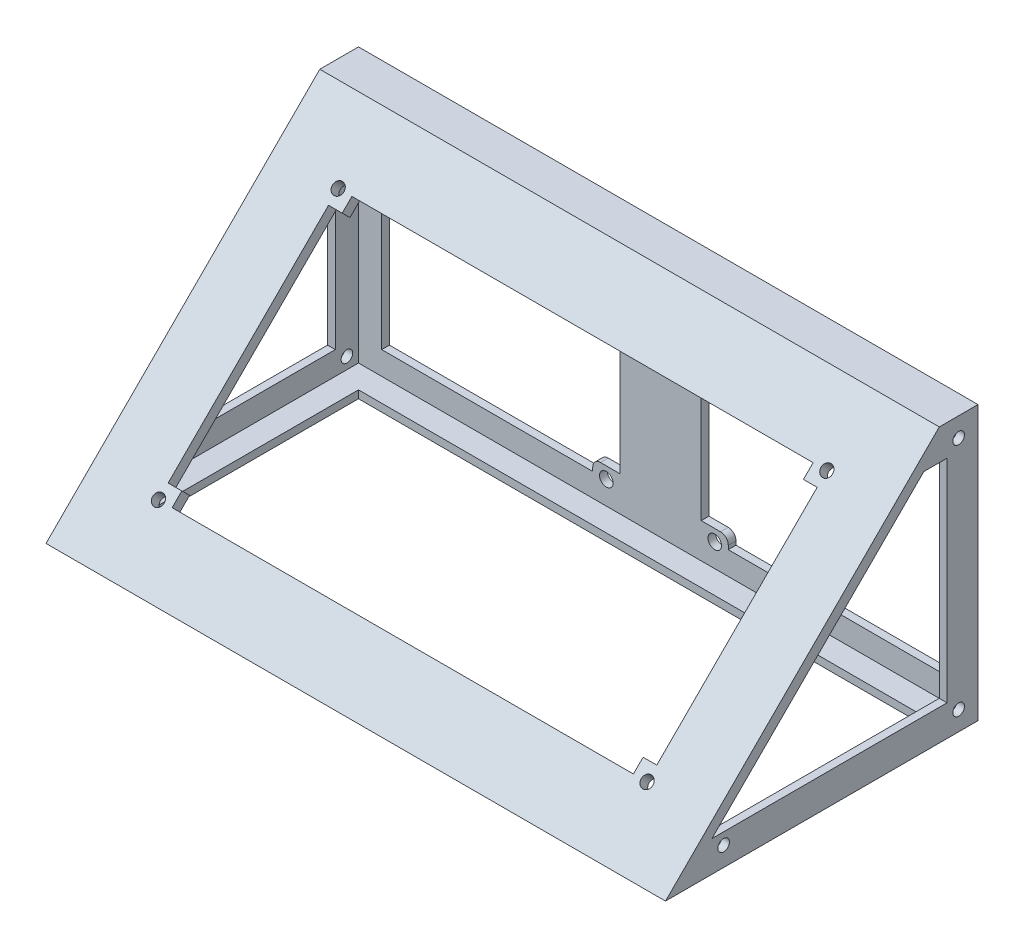
from build123d import *

# Parameters (mm, degrees)
ESQUISSE1_W                  = 35
ESQUISSE1_H                  = 35
BOSS_EXTRU_1_DEPTH           = 2
ESQUISSE2_R                  = 1.75
ESQUISSE2_W                  = 35
ESQUISSE2_H                  = 1.064971157
ENL_V_MAT_EXTRU_1_DEPTH      = 2
BOSS_EXTRU_2_DEPTH           = 280
ESQUISSE5_W                  = 7
ESQUISSE5_H                  = 6
ESQUISSE5_R                  = 1.75
BOSS_EXTRU_3_DEPTH           = 2
ESQUISSE6_R                  = 1.75
BOSS_EXTRU_4_DEPTH           = 2
ESQUISSE10_W                 = 35
ESQUISSE10_H                 = 33.935028843
ESQUISSE10_R                 = 1.75
BOSS_EXTRU_5_DEPTH           = 2
ESQUISSE15_R                 = 6.5
ESQUISSE15_R_2               = 1.75
ENL_V_MAT_EXTRU_2_DEPTH      = 373
CONG_1_R                     = 2
CONG_2_R                     = 4
EXTRU_MINCE1_START           = -2
EXTRU_MINCE1_OUTLINE_W       = 35
EXTRU_MINCE1_OUTLINE_H       = 10
EXTRU_MINCE1_DEPTH           = 2
BOSS_EXTRU_7_DEPTH           = 62.5
BOSS_EXTRU_8_DEPTH           = 160
ENL_V_MAT_EXTRU_4_DEPTH      = 15
BOSS_EXTRU_31_DEPTH          = 69.5
BOSS_EXTRU_31_DEPTH_BACK     = 90.5
ESQUISSE29_W                 = 0.210775501
ESQUISSE29_H                 = 2
BOSS_EXTRU_32_DEPTH          = 160
ENL_V_MAT_EXTRU_7_DEPTH      = 10
ENL_V_MAT_EXTRU_7_DEPTH_BACK = 5
ESQUISSE34_W                 = 144
ESQUISSE34_H                 = 64.710678118
ENL_V_MAT_EXTRU_8_DEPTH      = 2
ESQUISSE35_R                 = 1.5
BOSS_EXTRU_35_DEPTH          = 2
BOSS_EXTRU_36_START          = -2
ESQUISSE36_R                 = 1.5
BOSS_EXTRU_36_DEPTH          = 2
BOSS_EXTRU_37_DEPTH          = 21
BOSS_EXTRU_38_DEPTH          = 28
ESQUISSE42_W                 = 17
ESQUISSE42_H                 = 6
ENL_V_MAT_EXTRU_9_DEPTH      = 124
ESQUISSE43_R                 = 1.1
ENL_V_MAT_EXTRU_11_DEPTH     = 50
ESQUISSE45_R                 = 1.5
ENL_V_MAT_EXTRU_12_DEPTH     = 50
ESQUISSE47_R                 = 1.75
BOSS_EXTRU_40_DEPTH          = 2
ENL_V_MAT_EXTRU_13_DEPTH     = 2
ESQUISSE49_R                 = 1.75
BOSS_EXTRU_41_DEPTH          = 2
ESQUISSE50_W                 = 12.927363302
ESQUISSE50_H                 = 18
ENL_V_MAT_EXTRU_14_DEPTH     = 2
ESQUISSE51_R                 = 1.75
BOSS_EXTRU_42_DEPTH          = 2
BOSS_EXTRU_43_DEPTH          = 2
BOSS_EXTRU_43_DEPTH_BACK     = 2
ESQUISSE53_R                 = 1.75
ENL_V_START                  = -2
ESQUISSE54_R                 = 1.75
ENL_V_MAT_EXTRU_15_DEPTH     = 2
BOSS_EXTRU_44_DEPTH          = 2
BOSS_EXTRU_44_DEPTH_BACK     = 2
ESQUISSE55_R                 = 1.75
ENL_V_MAT_EXTRU_18_DEPTH     = 347
ENL_V_MAT_EXTRU_19_DEPTH     = 347
ESQUISSE62_W                 = 8
ESQUISSE62_H                 = 1.374343966
BOSS_EXTRU_45_DEPTH          = 134


# Read off the part's stored shape, not the designer's step: Extru.-Mince1
with BuildPart() as part:
    # Esquisse1 → Boss.-Extru.1 (new body)
    with BuildSketch(Plane(origin=(0, 0, 0), x_dir=(1, 0, 0), z_dir=(0, 1, 0))):
        with Locations((17.5, -17.5)):
            Rectangle(ESQUISSE1_W, ESQUISSE1_H)
    extrude(amount=BOSS_EXTRU_1_DEPTH)

    # Esquisse2 → Enlèv. mat.-Extru.1 (cut)
    with BuildSketch(Plane(origin=(0, 2, 0), x_dir=(1, 0, 0), z_dir=(0, 1, 0))):
        with Locations(Location((30.935029054, -4.064971369, 0), (0, 0, 270))):
            Circle(ESQUISSE2_R)
        with Locations(Location((30.935028843, -30.935028843, 0), (0, 0, 270))):
            Circle(ESQUISSE2_R)
        with Locations(Location((4.064971369, -4.064970946, 0), (0, 0, 270))):
            Circle(ESQUISSE2_R)
        with Locations(Location((4.064971157, -30.935028843, 0), (0, 0, 270))):
            Circle(ESQUISSE2_R)
        with Locations((17.5, -34.467514421)):
            Rectangle(ESQUISSE2_W, ESQUISSE2_H)
    extrude(amount=-ENL_V_MAT_EXTRU_1_DEPTH, mode=Mode.SUBTRACT)

    # Esquisse4 → Boss.-Extru.2 (add)
    with BuildSketch(Plane(origin=(0, 2, 0), x_dir=(1, 0, 0), z_dir=(0, 1, 0))):
        Polygon((17.5, -33.935028843), (7, -33.935028843), (7, -4.064970946), (28, -4.064970946), (28, -33.935028843), align=None)
    extrude(amount=BOSS_EXTRU_2_DEPTH)

    # Esquisse5 → Boss.-Extru.3 (add)
    # profile 1 of 4: a face of its own
    with BuildSketch(Plane.XY.offset(33.935028843)):
        with Locations((31.5, 254)):
            Rectangle(ESQUISSE5_W, ESQUISSE5_H)
        with Locations((31.5, 254)):
            Circle(ESQUISSE5_R, mode=Mode.SUBTRACT)
    # profile 2 of 4: a face of its own
    with BuildSketch(Plane.XY.offset(33.935028843)):
        with Locations((3.5, 254)):
            Rectangle(ESQUISSE5_W, ESQUISSE5_H)
        with Locations((3.5, 254)):
            Circle(ESQUISSE5_R, mode=Mode.SUBTRACT)
    # profile 3 of 4: a face of its own
    with BuildSketch(Plane.XY.offset(33.935028843)):
        with Locations((31.5, 28)):
            Rectangle(ESQUISSE5_W, ESQUISSE5_H)
        with Locations((31.5, 28)):
            Circle(ESQUISSE5_R, mode=Mode.SUBTRACT)
    # profile 4 of 4: a face of its own
    with BuildSketch(Plane.XY.offset(33.935028843)):
        with Locations((3.5, 28)):
            Rectangle(ESQUISSE5_W, ESQUISSE5_H)
        with Locations((3.5, 28)):
            Circle(ESQUISSE5_R, mode=Mode.SUBTRACT)
    extrude(amount=-BOSS_EXTRU_3_DEPTH)

    # Esquisse6 → Boss.-Extru.4 (add)
    # profile 1 of 2: a face of its own
    with BuildSketch(Plane.XY.offset(33.935028843)):
        Polygon((7, 144), (0, 144), (0, 141), (0, 138), (7, 138), (7, 141), align=None)
        with Locations((3.5, 141)):
            Circle(ESQUISSE6_R, mode=Mode.SUBTRACT)
    # profile 2 of 2: a face of its own
    with BuildSketch(Plane.XY.offset(33.935028843)):
        Polygon((35, 144), (28, 144), (28, 141), (28, 138), (35, 138), (35, 141), align=None)
        with Locations((31.5, 141)):
            Circle(ESQUISSE6_R, mode=Mode.SUBTRACT)
    extrude(amount=-BOSS_EXTRU_4_DEPTH)

    # Esquisse10 → Boss.-Extru.5 (add)
    with BuildSketch(Plane(origin=(0, 282, 0), x_dir=(1, 0, 0), z_dir=(0, 1, 0))):
        with Locations((17.5, -16.967514422)):
            Rectangle(ESQUISSE10_W, ESQUISSE10_H)
        with Locations(Location((30.935028843, -30.935028843, 0), (0, 0, 270))):
            Circle(ESQUISSE10_R, mode=Mode.SUBTRACT)
        with Locations(Location((30.935028631, -4.064970946, 0), (0, 0, 270.000013863))):
            Circle(ESQUISSE10_R, mode=Mode.SUBTRACT)
        with Locations(Location((4.064970946, -4.064971369, 0), (0, 0, 270.000013863))):
            Circle(ESQUISSE10_R, mode=Mode.SUBTRACT)
        with Locations(Location((4.064971157, -30.935028843, 0), (0, 0, 270))):
            Circle(ESQUISSE10_R, mode=Mode.SUBTRACT)
    extrude(amount=-BOSS_EXTRU_5_DEPTH)

    # Esquisse15 → Enlèv. mat.-Extru.2 (cut)
    with BuildSketch(Plane(origin=(0, 282, 0), x_dir=(1, 0, 0), z_dir=(0, 1, 0))):
        with Locations(Location((17.5, -17.5, 0), (0, 0, 270))):
            Circle(ESQUISSE15_R)
        with Locations(Location((30.935029054, -4.064971369, 0), (0, 0, 270))):
            Circle(ESQUISSE15_R_2)
    extrude(amount=-ENL_V_MAT_EXTRU_2_DEPTH, mode=Mode.SUBTRACT)

    # Congé1
    cong_1_edges = [part.edges().sort_by_distance(p)[0] for p in [
        (0, 31, 32.935028843),
        (0, 25, 32.935028843),
        (0, 144, 32.935028843),
        (0, 138, 32.935028843),
        (35, 144, 32.935028843),
        (35, 138, 32.935028843),
        (35, 257, 32.935028843),
        (35, 251, 32.935028843),
        (0, 251, 32.935028843),
        (0, 257, 32.935028843),
        (35, 31, 32.935028843),
        (35, 25, 32.935028843),
    ]]
    fillet(cong_1_edges, radius=CONG_1_R)

    # Congé2
    cong_2_edges = [part.edges().sort_by_distance(p)[0] for p in [
        (35, 281, 0),
        (0, 281, 0),
        (0, 1, 0),
        (35, 1, 0),
    ]]
    fillet(cong_2_edges, radius=CONG_2_R)

    # Extru.-Mince1 outline → Extru.-Mince1 (add)
    with BuildSketch(Plane(origin=(0, 282, 0), x_dir=(1, 0, 0), z_dir=(0, 1, 0)).offset(EXTRU_MINCE1_START)):
        with Locations((17.5, -38.935028843)):
            Rectangle(EXTRU_MINCE1_OUTLINE_W, EXTRU_MINCE1_OUTLINE_H)
    extrude(amount=EXTRU_MINCE1_DEPTH)

    # Esquisse20 → Boss.-Extru.7 (add)
    with BuildSketch(Plane.ZY):
        Polygon((43.935028843, 282), (114.645706961, 211.289321881), (110.645706961, 211.289321881), (41.935028843, 280), (34.145804344, 280), (34.145804344, 282), align=None)
    extrude(amount=BOSS_EXTRU_7_DEPTH)

    # Esquisse21 → Boss.-Extru.8 (add)
    with BuildSketch(Plane.ZY.offset(62.5)):
        Polygon((34.145804344, 280), (41.935028843, 280), (110.645706961, 211.289321881), (114.645706961, 211.289321881), (43.935028843, 282), (34.145804344, 282), align=None)
    extrude(amount=-BOSS_EXTRU_8_DEPTH)

    # Esquisse22 → Enlèv. mat.-Extru.4 (cut)
    with BuildSketch(Plane(origin=(0, 162.967514421, 162.967514421), x_dir=(1, 0, 0), z_dir=(0, 0.7071067811865462, 0.7071067811865488))):
        Polygon((-42.064466094, 147.626821562), (-45.6, 147.626821562), (-45.6, 89.047889374), (-42.064466094, 89.047889374), (-42.064466094, 85.512355468), (77.064466094, 85.512355468), (77.064466094, 89.047889374), (80.6, 89.047889374), (80.6, 147.626821562), (77.064466094, 147.626821562), (77.064466094, 151.162355468), (-42.064466094, 151.162355468), align=None)
    extrude(amount=-ENL_V_MAT_EXTRU_4_DEPTH, mode=Mode.SUBTRACT)

    # Esquisse29 → Boss.-Extru.31 (add, two sides: drawn at the far end of the back side and taken through both)
    with BuildSketch(Plane.ZY.offset(-7).offset(-BOSS_EXTRU_31_DEPTH_BACK)):
        with Locations((34.040416594, 281)):
            Rectangle(ESQUISSE29_W, ESQUISSE29_H)
    extrude(amount=BOSS_EXTRU_31_DEPTH + BOSS_EXTRU_31_DEPTH_BACK)

    # Esquisse32 → Boss.-Extru.32 (add)
    with BuildSketch(Plane.ZY.offset(62.5)):
        Polygon((110.645706961, 211.289321881), (33.935028843, 211.289321881), (33.935028843, 280), (35.935028843, 280), (35.935028843, 213.289321881), (108.645706961, 213.289321881), align=None)
    extrude(amount=-BOSS_EXTRU_32_DEPTH)

    # Esquisse33 → Enlèv. mat.-Extru.7 (cut, two sides: drawn at the far end of the back side and taken through both)
    with BuildSketch(Plane(origin=(0, 0, 33.935028843), x_dir=(-1, 0, 0), z_dir=(0, 0, -1)).offset(-ENL_V_MAT_EXTRU_7_DEPTH_BACK)):
        Polygon((-28, 274.000000001), (-89.5, 274.000000001), (-89.5, 219.289321881), (-81.5, 219.289321881), (-28, 219.289321881), align=None)
        with BuildLine():
            Line((54.5, 274.000000001), (-7, 274.000000001))
            Line((-7, 274.000000001), (-7, 257))
            Line((-7, 257), (-2, 257))
            ThreePointArc((-2, 257), (-0.585786438, 256.414213562), (0, 255))
            Line((0, 255), (0, 253))
            ThreePointArc((0, 253), (-0.585786438, 251.585786438), (-2, 251))
            Line((-2, 251), (-7, 251))
            Line((-7, 251), (-7, 219.289321881))
            Line((-7, 219.289321881), (1, 219.289321881))
            Line((1, 219.289321881), (54.5, 219.289321881))
            Line((54.5, 219.289321881), (54.5, 274.000000001))
        make_face()
        with BuildLine():
            Line((-2, 257), (-7, 257))
            Line((-7, 257), (-7, 251))
            Line((-7, 251), (-2, 251))
            ThreePointArc((-2, 251), (-0.585786438, 251.585786438), (0, 253))
            Line((0, 253), (0, 255))
            ThreePointArc((0, 255), (-0.585786438, 256.414213562), (-2, 257))
        make_face()
    extrude(amount=ENL_V_MAT_EXTRU_7_DEPTH + ENL_V_MAT_EXTRU_7_DEPTH_BACK, mode=Mode.SUBTRACT)

    # Esquisse34 → Enlèv. mat.-Extru.8 (cut)
    with BuildSketch(Plane.XZ.offset(-211.289321881)):
        with Locations((17.5, 74.290367902)):
            Rectangle(ESQUISSE34_W, ESQUISSE34_H)
    extrude(amount=-ENL_V_MAT_EXTRU_8_DEPTH, mode=Mode.SUBTRACT)

    # Esquisse35 → Boss.-Extru.35 (add)
    with BuildSketch(Plane(origin=(97.5, 0, 0), x_dir=(0, 0, -1), z_dir=(1, 0, 0))):
        Polygon((-35.935028843, 280), (-35.935028843, 274.000000001), (-35.935028843, 213.289321881), (-108.645706961, 213.289321881), (-102.645706961, 219.289321881), (-41.935028842, 219.289321881), (-41.935028842, 274.000000001), (-47.935028841, 274.000000001), (-41.935028843, 280), align=None)
        with Locations((-38.935028842, 216.289321881)):
            Circle(ESQUISSE35_R, mode=Mode.SUBTRACT)
        with Locations((-38.935028842, 277.000000001)):
            Circle(ESQUISSE35_R, mode=Mode.SUBTRACT)
        with Locations((-99.645706961, 216.289321881)):
            Circle(ESQUISSE35_R, mode=Mode.SUBTRACT)
    extrude(amount=-BOSS_EXTRU_35_DEPTH)

    # Esquisse36 → Boss.-Extru.36 (add)
    with BuildSketch(Plane.ZY.offset(62.5).offset(BOSS_EXTRU_36_START)):
        Polygon((35.935028843, 213.289321881), (108.645706961, 213.289321881), (102.645706961, 219.289321881), (41.935028842, 219.289321881), (41.935028842, 274.000000001), (47.935028841, 274.000000001), (41.935028843, 280), (35.935028843, 280), (35.935028843, 274.000000001), align=None)
        with Locations(Location((99.645706961, 216.289321881, 0), (0, 0, 180))):
            Circle(ESQUISSE36_R, mode=Mode.SUBTRACT)
        with Locations(Location((38.935028842, 277.000000001, 0), (0, 0, 180))):
            Circle(ESQUISSE36_R, mode=Mode.SUBTRACT)
        with Locations(Location((38.935028842, 216.289321881, 0), (0, 0, 180))):
            Circle(ESQUISSE36_R, mode=Mode.SUBTRACT)
    extrude(amount=BOSS_EXTRU_36_DEPTH)

    # Esquisse39 → Boss.-Extru.37 (add)
    with BuildSketch(Plane(origin=(28, 0, 0), x_dir=(0, 0, -1), z_dir=(1, 0, 0))):
        Polygon((-33.935028843, 211.289321881), (-33.935028843, 191.289321881), (-118.935028843, 201.289321881), (-118.935028843, 211.289321881), align=None)
    extrude(amount=-BOSS_EXTRU_37_DEPTH)

    # Esquisse40 → Boss.-Extru.38 (add)
    with BuildSketch(Plane.XY.offset(118.935028843)):
        Polygon((7, 201.289321881), (2, 201.289321881), (2, 203.289321881), (33, 203.289321881), (33, 201.289321881), (28, 201.289321881), align=None)
    extrude(amount=BOSS_EXTRU_38_DEPTH)

    # Esquisse42 → Enlèv. mat.-Extru.9 (cut)
    with BuildSketch(Plane.XY.offset(118.935028843)):
        with Locations((17.5, 208.289321881)):
            Rectangle(ESQUISSE42_W, ESQUISSE42_H)
    extrude(amount=-ENL_V_MAT_EXTRU_9_DEPTH, mode=Mode.SUBTRACT)

    # Esquisse43 → Enlèv. mat.-Extru.11 (cut)
    with BuildSketch(Plane(origin=(0, 203.289321881, 0), x_dir=(1, 0, 0), z_dir=(0, 1, 0))):
        with Locations(Location((5, -144.935028843, 0), (0, 0, 270))):
            Circle(ESQUISSE43_R)
        with Locations(Location((30, -144.935028843, 0), (0, 0, 270))):
            Circle(ESQUISSE43_R)
        with Locations(Location((5, -130.435028843, 0), (0, 0, 270))):
            Circle(ESQUISSE43_R)
        with Locations(Location((30, -130.435028843, 0), (0, 0, 270))):
            Circle(ESQUISSE43_R)
        with BuildLine():
            Line((5, -123.319506434), (5, -128.435028843))
            ThreePointArc((5, -128.435028843), (7, -130.435028843), (5, -132.435028843))
            Line((5, -132.435028843), (5, -142.935028843))
            ThreePointArc((5, -142.935028843), (6.414213562, -143.52081528), (7, -144.935028843))
            Line((7, -144.935028843), (28, -144.935028843))
            ThreePointArc((28, -144.935028843), (28.585786438, -143.52081528), (30, -142.935028843))
            Line((30, -142.935028843), (30, -132.435028843))
            ThreePointArc((30, -132.435028843), (28, -130.435028843), (30, -128.435028843))
            Line((30, -128.435028843), (30, -123.319506434))
            Line((30, -123.319506434), (5, -123.319506434))
        make_face()
    extrude(amount=-ENL_V_MAT_EXTRU_11_DEPTH, mode=Mode.SUBTRACT)

    # Esquisse45 → Enlèv. mat.-Extru.12 (cut)
    with BuildSketch(Plane(origin=(0, 162.967514421, 162.967514421), x_dir=(1, 0, 0), z_dir=(0, 0.7071067811865462, 0.7071067811865488))):
        with Locations(Location((80.6, 151.162355468, 0), (0, 0, 270))):
            Circle(ESQUISSE45_R)
        with Locations(Location((80.6, 85.512355468, 0), (0, 0, 270))):
            Circle(ESQUISSE45_R)
        with Locations(Location((-45.6, 85.512355468, 0), (0, 0, 270))):
            Circle(ESQUISSE45_R)
        with Locations(Location((-45.6, 151.162355468, 0), (0, 0, 270))):
            Circle(ESQUISSE45_R)
    extrude(amount=-ENL_V_MAT_EXTRU_12_DEPTH, mode=Mode.SUBTRACT)

    # Esquisse47 → Boss.-Extru.40 (add)
    # profile 1 of 4: a face of its own
    with BuildSketch(Plane.XY.offset(33.935028843)):
        with BuildLine():
            Line((2, 144), (7, 144))
            Line((7, 144), (7, 150))
            Line((7, 150), (2, 150))
            ThreePointArc((2, 150), (0.585786438, 149.414213562), (0, 148))
            Line((0, 148), (0, 146))
            ThreePointArc((0, 146), (0.585786438, 144.585786438), (2, 144))
        make_face()
        with Locations((3.5, 147)):
            Circle(ESQUISSE47_R, mode=Mode.SUBTRACT)
    # profile 2 of 4: a face of its own
    with BuildSketch(Plane.XY.offset(33.935028843)):
        with BuildLine():
            Line((28, 150), (28, 144))
            Line((28, 144), (33, 144))
            ThreePointArc((33, 144), (34.414213562, 144.585786438), (35, 146))
            Line((35, 146), (35, 148))
            ThreePointArc((35, 148), (34.414213562, 149.414213562), (33, 150))
            Line((33, 150), (28, 150))
        make_face()
        with Locations((31.5, 147)):
            Circle(ESQUISSE47_R, mode=Mode.SUBTRACT)
    # profile 3 of 4: a face of its own
    with BuildSketch(Plane.XY.offset(33.935028843)):
        with BuildLine():
            Line((35, 134), (35, 136))
            ThreePointArc((35, 136), (34.414213562, 137.414213562), (33, 138))
            Line((33, 138), (28, 138))
            Line((28, 138), (28, 132))
            Line((28, 132), (33, 132))
            ThreePointArc((33, 132), (34.414213562, 132.585786438), (35, 134))
        make_face()
        with Locations((31.5, 135)):
            Circle(ESQUISSE47_R, mode=Mode.SUBTRACT)
    # profile 4 of 4: a face of its own
    with BuildSketch(Plane.XY.offset(33.935028843)):
        with BuildLine():
            Line((7, 138), (2, 138))
            ThreePointArc((2, 138), (0.585786438, 137.414213562), (0, 136))
            Line((0, 136), (0, 134))
            ThreePointArc((0, 134), (0.585786438, 132.585786438), (2, 132))
            Line((2, 132), (7, 132))
            Line((7, 132), (7, 138))
        make_face()
        with Locations((3.5, 135)):
            Circle(ESQUISSE47_R, mode=Mode.SUBTRACT)
    extrude(amount=-BOSS_EXTRU_40_DEPTH)

    # Esquisse48 → Enlèv. mat.-Extru.13 (cut)
    with BuildSketch(Plane.XY.offset(33.935028843)):
        Polygon((-4.556540033, 144), (-4.556540033, 138), (2, 138), (7, 138), (7, 144), (2, 144), align=None)
        Polygon((33.295178048, 144), (39.851718081, 144), (39.851718081, 138), (33.295178048, 138), (28.295178048, 138), (28.295178048, 144), align=None)
    extrude(amount=-ENL_V_MAT_EXTRU_13_DEPTH, mode=Mode.SUBTRACT)

    # Esquisse49 → Boss.-Extru.41 (add)
    # profile 1 of 2: a face of its own
    with BuildSketch(Plane.XY.offset(33.935028843)):
        with BuildLine():
            Line((2, 180.289321881), (7, 180.289321881))
            Line((7, 180.289321881), (7, 186.289321881))
            Line((7, 186.289321881), (2, 186.289321881))
            ThreePointArc((2, 186.289321881), (0.585786438, 185.703535444), (0, 184.289321881))
            Line((0, 184.289321881), (0, 182.289321881))
            ThreePointArc((0, 182.289321881), (0.585786438, 180.875108319), (2, 180.289321881))
        make_face()
        with Locations((3.5, 183.289321881)):
            Circle(ESQUISSE49_R, mode=Mode.SUBTRACT)
    # profile 2 of 2: a face of its own
    with BuildSketch(Plane.XY.offset(33.935028843)):
        with BuildLine():
            Line((35, 182.289321881), (35, 184.289321881))
            ThreePointArc((35, 184.289321881), (34.414213562, 185.703535444), (33, 186.289321881))
            Line((33, 186.289321881), (28, 186.289321881))
            Line((28, 186.289321881), (28, 180.289321881))
            Line((28, 180.289321881), (33, 180.289321881))
            ThreePointArc((33, 180.289321881), (34.414213562, 180.875108319), (35, 182.289321881))
        make_face()
        with Locations((31.5, 183.289321881)):
            Circle(ESQUISSE49_R, mode=Mode.SUBTRACT)
    extrude(amount=-BOSS_EXTRU_41_DEPTH)

    # Esquisse50 → Enlèv. mat.-Extru.14 (cut)
    with BuildSketch(Plane.XY.offset(33.935028843)):
        with Locations((34.463681651, 141)):
            Rectangle(ESQUISSE50_W, ESQUISSE50_H)
    extrude(amount=-ENL_V_MAT_EXTRU_14_DEPTH, mode=Mode.SUBTRACT)

    # Esquisse51 → Boss.-Extru.42 (add)
    # profile 1 of 3: a face of its own
    with BuildSketch(Plane.XY.offset(33.935028843)):
        with BuildLine():
            Line((7, 150), (7, 144))
            Line((7, 144), (2, 144))
            ThreePointArc((2, 144), (0.585786438, 144.585786438), (0, 146))
            Line((0, 146), (0, 148))
            ThreePointArc((0, 148), (0.585786438, 149.414213562), (2, 150))
            Line((2, 150), (7, 150))
        make_face()
        with Locations((3.5, 147)):
            Circle(ESQUISSE51_R, mode=Mode.SUBTRACT)
    # profile 2 of 3: a face of its own
    with BuildSketch(Plane.XY.offset(33.935028843)):
        with BuildLine():
            Line((33, 138.018442997), (28, 138.018442997))
            Line((28, 138.018442997), (28, 132.018442997))
            Line((28, 132.018442997), (33, 132.018442997))
            ThreePointArc((33, 132.018442997), (34.414213562, 132.604229434), (35, 134.018442997))
            Line((35, 134.018442997), (35, 136.018442997))
            ThreePointArc((35, 136.018442997), (34.414213562, 137.432656559), (33, 138.018442997))
        make_face()
        with Locations((31.5, 135.018442997)):
            Circle(ESQUISSE51_R, mode=Mode.SUBTRACT)
    # profile 3 of 3: a face of its own
    with BuildSketch(Plane.XY.offset(33.935028843)):
        with BuildLine():
            Line((33, 150), (28, 150))
            Line((28, 150), (28, 144))
            Line((28, 144), (33, 144))
            ThreePointArc((33, 144), (34.414213562, 144.585786438), (35, 146))
            Line((35, 146), (35, 148))
            ThreePointArc((35, 148), (34.414213562, 149.414213562), (33, 150))
        make_face()
        with Locations((31.5, 147)):
            Circle(ESQUISSE51_R, mode=Mode.SUBTRACT)
    extrude(amount=-BOSS_EXTRU_42_DEPTH)

    # Esquisse53 → Boss.-Extru.43 (add, two sides: drawn at the far end of the back side and taken through both)
    # profile 1 of 4: a face of its own
    with BuildSketch(Plane(origin=(0, 0, 33.935028843), x_dir=(-1, 0, 0), z_dir=(0, 0, -1)).offset(-BOSS_EXTRU_43_DEPTH_BACK)):
        with BuildLine():
            Line((0, 275.000000001), (0, 273.000000001))
            ThreePointArc((0, 273.000000001), (-0.585786438, 271.585786439), (-2, 271.000000001))
            Line((-2, 271.000000001), (-7, 271.000000001))
            Line((-7, 271.000000001), (-7, 277.000000001))
            Line((-7, 277.000000001), (-2, 277.000000001))
            ThreePointArc((-2, 277.000000001), (-0.585786438, 276.414213564), (0, 275.000000001))
        make_face()
        with Locations(Location((-3.5, 274.000000001, 0), (0, 0, 180))):
            Circle(ESQUISSE53_R, mode=Mode.SUBTRACT)
    # profile 2 of 4: a face of its own
    with BuildSketch(Plane(origin=(0, 0, 33.935028843), x_dir=(-1, 0, 0), z_dir=(0, 0, -1)).offset(-BOSS_EXTRU_43_DEPTH_BACK)):
        with BuildLine():
            Line((-28, 222.289321881), (-28, 216.289321881))
            Line((-28, 216.289321881), (-33, 216.289321881))
            ThreePointArc((-33, 216.289321881), (-34.414213562, 216.875108319), (-35, 218.289321881))
            Line((-35, 218.289321881), (-35, 220.289321881))
            ThreePointArc((-35, 220.289321881), (-34.414213562, 221.703535444), (-33, 222.289321881))
            Line((-33, 222.289321881), (-28, 222.289321881))
        make_face()
        with Locations((-31.5, 219.289321881)):
            Circle(ESQUISSE53_R, mode=Mode.SUBTRACT)
    # profile 3 of 4: a face of its own
    with BuildSketch(Plane(origin=(0, 0, 33.935028843), x_dir=(-1, 0, 0), z_dir=(0, 0, -1)).offset(-BOSS_EXTRU_43_DEPTH_BACK)):
        with BuildLine():
            Line((-28, 277.000000001), (-28, 271.000000001))
            Line((-28, 271.000000001), (-33, 271.000000001))
            ThreePointArc((-33, 271.000000001), (-34.414213562, 271.585786439), (-35, 273.000000001))
            Line((-35, 273.000000001), (-35, 275.000000001))
            ThreePointArc((-35, 275.000000001), (-34.414213562, 276.414213564), (-33, 277.000000001))
            Line((-33, 277.000000001), (-28, 277.000000001))
        make_face()
        with Locations((-31.5, 274.000000001)):
            Circle(ESQUISSE53_R, mode=Mode.SUBTRACT)
    # profile 4 of 4: a face of its own
    with BuildSketch(Plane(origin=(0, 0, 33.935028843), x_dir=(-1, 0, 0), z_dir=(0, 0, -1)).offset(-BOSS_EXTRU_43_DEPTH_BACK)):
        with BuildLine():
            Line((0, 220.289321881), (0, 218.289321881))
            ThreePointArc((0, 218.289321881), (-0.585786438, 216.875108319), (-2, 216.289321881))
            Line((-2, 216.289321881), (-7, 216.289321881))
            Line((-7, 216.289321881), (-7, 222.289321881))
            Line((-7, 222.289321881), (-2, 222.289321881))
            ThreePointArc((-2, 222.289321881), (-0.585786438, 221.703535444), (0, 220.289321881))
        make_face()
        with Locations(Location((-3.5, 219.289321881, 0), (0, 0, 180))):
            Circle(ESQUISSE53_R, mode=Mode.SUBTRACT)
    extrude(amount=BOSS_EXTRU_43_DEPTH + BOSS_EXTRU_43_DEPTH_BACK)

    # Esquisse54 → Enlèv. mat.-Extru.15 (cut)
    with BuildSketch(Plane(origin=(0, 0, 33.935028843), x_dir=(-1, 0, 0), z_dir=(0, 0, -1)).offset(ENL_V_START)):
        with Locations((-31.5, 274.000000001)):
            Circle(ESQUISSE54_R)
        with Locations(Location((-3.5, 274.000000001, 0), (0, 0, 180))):
            Circle(ESQUISSE54_R)
        with Locations((-31.5, 219.289321881)):
            Circle(ESQUISSE54_R)
        with Locations(Location((-3.5, 219.289321881, 0), (0, 0, 180))):
            Circle(ESQUISSE54_R)
    extrude(amount=ENL_V_MAT_EXTRU_15_DEPTH, mode=Mode.SUBTRACT)

    # Esquisse55 → Boss.-Extru.44 (add, two sides: drawn at the far end of the back side and taken through both)
    # profile 1 of 2: a face of its own
    with BuildSketch(Plane(origin=(0, 0, 33.935028843), x_dir=(-1, 0, 0), z_dir=(0, 0, -1)).offset(-BOSS_EXTRU_44_DEPTH_BACK)):
        with BuildLine():
            Line((0, 207.789321881), (0, 205.789321881))
            Line((0, 205.789321881), (0, 201.789321881))
            Line((0, 201.789321881), (0, 199.789321881))
            Line((0, 199.789321881), (0, 195.789321881))
            Line((0, 195.789321881), (0, 193.789321881))
            ThreePointArc((0, 193.789321881), (-0.585786438, 192.375108319), (-2, 191.789321881))
            Line((-2, 191.789321881), (-7, 191.789321881))
            Line((-7, 191.789321881), (-7, 197.789321881))
            Line((-7, 197.789321881), (-7, 203.789321881))
            Line((-7, 203.789321881), (-7, 209.789321881))
            Line((-7, 209.789321881), (-2, 209.789321881))
            ThreePointArc((-2, 209.789321881), (-0.585786438, 209.203535444), (0, 207.789321881))
        make_face()
        with Locations((-3.5, 206.789321881)):
            Circle(ESQUISSE55_R, mode=Mode.SUBTRACT)
        with Locations((-3.5, 194.789321881)):
            Circle(ESQUISSE55_R, mode=Mode.SUBTRACT)
        with Locations((-3.5, 200.789321881)):
            Circle(ESQUISSE55_R, mode=Mode.SUBTRACT)
    # profile 2 of 2: a face of its own
    with BuildSketch(Plane(origin=(0, 0, 33.935028843), x_dir=(-1, 0, 0), z_dir=(0, 0, -1)).offset(-BOSS_EXTRU_44_DEPTH_BACK)):
        with BuildLine():
            Line((-35, 195.789321881), (-35, 193.789321881))
            ThreePointArc((-35, 193.789321881), (-34.414213562, 192.375108319), (-33, 191.789321881))
            Line((-33, 191.789321881), (-28, 191.789321881))
            Line((-28, 191.789321881), (-28, 197.789321881))
            Line((-28, 197.789321881), (-28, 203.789321881))
            Line((-28, 203.789321881), (-28, 209.789321881))
            Line((-28, 209.789321881), (-33, 209.789321881))
            ThreePointArc((-33, 209.789321881), (-34.414213562, 209.203535444), (-35, 207.789321881))
            Line((-35, 207.789321881), (-35, 205.789321881))
            Line((-35, 205.789321881), (-35, 201.789321881))
            Line((-35, 201.789321881), (-35, 199.789321881))
            Line((-35, 199.789321881), (-35, 195.789321881))
        make_face()
        with Locations((-31.5, 194.789321881)):
            Circle(ESQUISSE55_R, mode=Mode.SUBTRACT)
        with Locations((-31.5, 206.789321881)):
            Circle(ESQUISSE55_R, mode=Mode.SUBTRACT)
        with Locations((-31.5, 200.789321881)):
            Circle(ESQUISSE55_R, mode=Mode.SUBTRACT)
    extrude(amount=BOSS_EXTRU_44_DEPTH + BOSS_EXTRU_44_DEPTH_BACK)

    # Esquisse58 → Enlèv. mat.-Extru.18 (cut)
    with BuildSketch(Plane(origin=(0, 282, 0), x_dir=(1, 0, 0), z_dir=(0, 1, 0))):
        Polygon((-62.5, -33.935028843), (-78.6806035, 56.359307264), (170.777216178, 50.921534628), (97.5, -33.935028843), align=None)
    extrude(amount=-ENL_V_MAT_EXTRU_18_DEPTH, mode=Mode.SUBTRACT)

    # Esquisse59 → Enlèv. mat.-Extru.19 (cut)
    with BuildSketch(Plane(origin=(0, 0, 33.935028843), x_dir=(-1, 0, 0), z_dir=(0, 0, -1))):
        Polygon((14.773980237, 211.289321881), (14.773980237, 177.707540822), (-45.784477836, 177.707540822), (-45.784477836, 212.312374007), align=None)
    extrude(amount=-ENL_V_MAT_EXTRU_19_DEPTH, mode=Mode.SUBTRACT)

    # Esquisse62 → Boss.-Extru.45 (add)
    with BuildSketch(Plane(origin=(97.5, 0, 0), x_dir=(0, 0, -1), z_dir=(1, 0, 0))):
        Polygon((-114.645706961, 211.289321881), (-106.645706961, 211.289321881), (-106.645706961, 212.663665847), (-113.271362995, 212.663665847), align=None)
        with Locations((-37.935028843, 211.976493864)):
            Rectangle(ESQUISSE62_W, ESQUISSE62_H)
    extrude(amount=-BOSS_EXTRU_45_DEPTH)


solid = part.part
